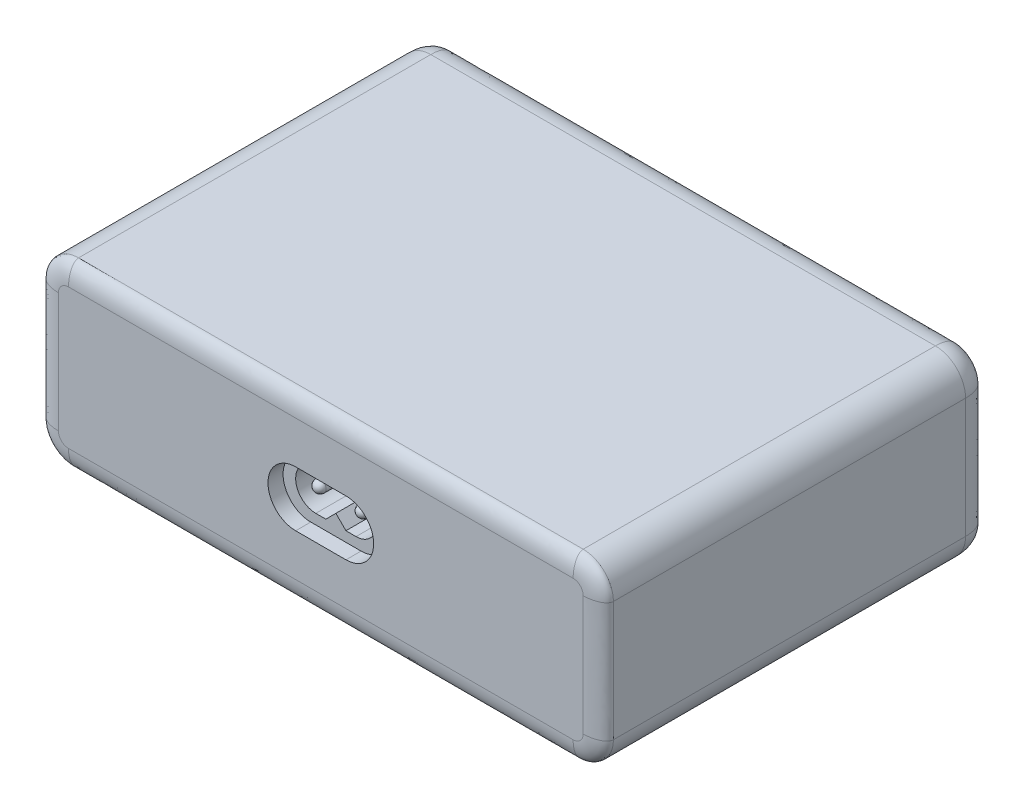
from build123d import *

# Parameters (mm, degrees)
SKETCH1_W           = 112.3
SKETCH1_H           = 76
BOSS_EXTRUDE1_DEPTH = 35.8
FILLET1_R           = 6
CUT_EXTRUDE1_DEPTH  = 3
CUT_EXTRUDE2_DEPTH  = 9.8
SKETCH4_R           = 1.18
BOSS_EXTRUDE2_DEPTH = 9.8
FILLET2_R           = 1.18
FILLET3_SIZE        = 4
FILLET3_SIZE_2      = 2
SKETCH5_W           = 12.4
SKETCH5_H           = 4.8
CUT_EXTRUDE3_DEPTH  = 10.7
CUT_EXTRUDE4_DEPTH  = 8
LPATTERN1_COUNT     = 4
LPATTERN1_PITCH     = 12.8


with BuildPart() as part:
    # Sketch1 → Boss-Extrude1 (new body)
    with BuildSketch(Plane(origin=(0, 0, 0), x_dir=(1, 0, 0), z_dir=(0, 1, 0))):
        with Locations((56.15, 38)):
            Rectangle(SKETCH1_W, SKETCH1_H)
    extrude(amount=BOSS_EXTRUDE1_DEPTH)

    # Fillet1
    fillet1_edges = [part.edges().sort_by_distance(p)[0] for p in [
        (112.3, 35.8, -38),
        (0, 35.8, -38),
        (112.3, 0, -38),
        (0, 0, -38),
    ]]
    fillet(fillet1_edges, radius=FILLET1_R)

    # Sketch2 → Cut-Extrude1 (cut)
    with BuildSketch(Plane.XY):
        with BuildLine():
            Line((51.15, 23.4), (61.15, 23.4))
            ThreePointArc((61.15, 23.4), (66.65, 17.9), (61.15, 12.4))
            Line((61.15, 12.4), (51.15, 12.4))
            ThreePointArc((51.15, 12.4), (45.65, 17.9), (51.15, 23.4))
        make_face()
    extrude(amount=-CUT_EXTRUDE1_DEPTH, mode=Mode.SUBTRACT)

    # Sketch3 → Cut-Extrude2 (cut)
    with BuildSketch(Plane.XY.offset(-3)):
        with BuildLine():
            Line((54.15, 22.4), (52.15, 22.4))
            ThreePointArc((52.15, 22.4), (48.15, 18.4), (52.15, 14.4))
            Line((52.15, 14.4), (54.162005251, 14.4))
            Line((54.162005251, 14.4), (56.15, 16.40598461))
            Line((56.15, 16.40598461), (58.137994749, 14.4))
            Line((58.137994749, 14.4), (60.15, 14.4))
            ThreePointArc((60.15, 14.4), (64.15, 18.4), (60.15, 22.4))
            Line((60.15, 22.4), (58.15, 22.4))
            Line((58.15, 22.4), (56.15, 20.40598461))
            Line((56.15, 20.40598461), (54.15, 22.4))
        make_face()
    extrude(amount=-CUT_EXTRUDE2_DEPTH, mode=Mode.SUBTRACT)

    # Sketch4 → Boss-Extrude2 (add)
    with BuildSketch(Plane.XY.offset(-12.8)):
        with Locations((51.85, 18.40598461)):
            Circle(SKETCH4_R)
        with Locations((60.45, 18.40598461)):
            Circle(SKETCH4_R)
    extrude(amount=BOSS_EXTRUDE2_DEPTH)

    # Fillet2
    fillet2_edges = [part.edges().sort_by_distance(p)[0] for p in [
        (50.67, 18.40598461, -3),
        (59.27, 18.40598461, -3),
    ]]
    fillet(fillet2_edges, radius=FILLET2_R)

    # Fillet3
    # an asymmetric fillet: 4, 2 mm, written as the material it takes off along each edge
    with BuildSketch(Plane(origin=(6, 0, 0), x_dir=(0, 1, 0), z_dir=(1, 0, 0)), Plane(origin=(106.3, 35.8, -76), x_dir=(0, 0, 1), z_dir=(-1, 0, 0))) as fillet3_piece_1:
        with BuildLine():
            Bezier((FILLET3_SIZE, 0), (0, 0), (0, -FILLET3_SIZE_2), weights=[1, 0.707106781, 1])
            Line((0, -FILLET3_SIZE_2), (0, 0))
            Line((0, 0), (FILLET3_SIZE, 0))
        make_face()
    extrude(amount=100.3, mode=Mode.SUBTRACT)
    with BuildSketch(Plane(origin=(6, 6, 0), x_dir=(-1, 0, 0), z_dir=(0, 1, 0))) as fillet3_piece_2:
        with BuildLine():
            Bezier((6 - FILLET3_SIZE, 0), (6, 0), (6, -FILLET3_SIZE_2), weights=[1, 0.707106781, 1])
            Line((6, -FILLET3_SIZE_2), (6, 0))
            Line((6, 0), (6 - FILLET3_SIZE, 0))
        make_face()
    revolve(axis=Axis((6, 6, 0), (0, 0, 1)), revolution_arc=90, mode=Mode.SUBTRACT)
    with BuildSketch(Plane(origin=(106.3, 6, 0), x_dir=(1, 0, 0), z_dir=(0, 1, 0))) as fillet3_piece_3:
        with BuildLine():
            Bezier((6 - FILLET3_SIZE, 0), (6, 0), (6, FILLET3_SIZE_2), weights=[1, 0.707106781, 1])
            Line((6, FILLET3_SIZE_2), (6, 0))
            Line((6, 0), (6 - FILLET3_SIZE, 0))
        make_face()
    revolve(axis=Axis((106.3, 6, 0), (0, 0, -1)), revolution_arc=90, mode=Mode.SUBTRACT)
    with BuildSketch(Plane(origin=(0, 6, 0), x_dir=(1, 0, 0), z_dir=(0, 1, 0)), Plane(origin=(0, 6, -76), x_dir=(0, 0, 1), z_dir=(0, 1, 0))) as fillet3_piece_4:
        with BuildLine():
            Bezier((FILLET3_SIZE, 0), (0, 0), (0, FILLET3_SIZE_2), weights=[1, 0.707106781, 1])
            Line((0, FILLET3_SIZE_2), (0, 0))
            Line((0, 0), (FILLET3_SIZE, 0))
        make_face()
    extrude(amount=23.8, mode=Mode.SUBTRACT)
    with BuildSketch(Plane(origin=(112.3, 6, 0), x_dir=(-1, 0, 0), z_dir=(0, 1, 0)), Plane(origin=(112.3, 6, -76), x_dir=(0, 0, 1), z_dir=(0, 1, 0))) as fillet3_piece_5:
        with BuildLine():
            Bezier((FILLET3_SIZE, 0), (0, 0), (0, -FILLET3_SIZE_2), weights=[1, 0.707106781, 1])
            Line((0, -FILLET3_SIZE_2), (0, 0))
            Line((0, 0), (FILLET3_SIZE, 0))
        make_face()
    extrude(amount=23.8, mode=Mode.SUBTRACT)
    with BuildSketch(Plane(origin=(6, 29.8, 0), x_dir=(-1, 0, 0), z_dir=(0, -1, 0))) as fillet3_piece_6:
        with BuildLine():
            Bezier((6 - FILLET3_SIZE, 0), (6, 0), (6, FILLET3_SIZE_2), weights=[1, 0.707106781, 1])
            Line((6, FILLET3_SIZE_2), (6, 0))
            Line((6, 0), (6 - FILLET3_SIZE, 0))
        make_face()
    revolve(axis=Axis((6, 29.8, 0), (0, 0, -1)), revolution_arc=90, mode=Mode.SUBTRACT)
    with BuildSketch(Plane(origin=(106.3, 29.8, 0), x_dir=(1, 0, 0), z_dir=(0, -1, 0))) as fillet3_piece_7:
        with BuildLine():
            Bezier((6 - FILLET3_SIZE, 0), (6, 0), (6, -FILLET3_SIZE_2), weights=[1, 0.707106781, 1])
            Line((6, -FILLET3_SIZE_2), (6, 0))
            Line((6, 0), (6 - FILLET3_SIZE, 0))
        make_face()
    revolve(axis=Axis((106.3, 29.8, 0), (0, 0, 1)), revolution_arc=90, mode=Mode.SUBTRACT)
    with BuildSketch(Plane(origin=(6, 35.8, 0), x_dir=(0, -1, 0), z_dir=(1, 0, 0)), Plane(origin=(106.3, 0, -76), x_dir=(0, 0, 1), z_dir=(-1, 0, 0))) as fillet3_piece_8:
        with BuildLine():
            Bezier((FILLET3_SIZE, 0), (0, 0), (0, FILLET3_SIZE_2), weights=[1, 0.707106781, 1])
            Line((0, FILLET3_SIZE_2), (0, 0))
            Line((0, 0), (FILLET3_SIZE, 0))
        make_face()
    extrude(amount=100.3, mode=Mode.SUBTRACT)
    with BuildSketch(Plane(origin=(106.3, 6, -76), x_dir=(1, 0, 0), z_dir=(0, 1, 0))) as fillet3_piece_9:
        with BuildLine():
            Bezier((6, -FILLET3_SIZE), (6, 0), (6 - FILLET3_SIZE_2, 0), weights=[1, 0.707106781, 1])
            Line((6 - FILLET3_SIZE_2, 0), (6, 0))
            Line((6, 0), (6, -FILLET3_SIZE))
        make_face()
    revolve(axis=Axis((106.3, 6, -76), (0, 0, -1)), revolution_arc=90, mode=Mode.SUBTRACT)
    with BuildSketch(Plane(origin=(6, 6, -76), x_dir=(-1, 0, 0), z_dir=(0, 1, 0))) as fillet3_piece_10:
        with BuildLine():
            Bezier((6, FILLET3_SIZE), (6, 0), (6 - FILLET3_SIZE_2, 0), weights=[1, 0.707106781, 1])
            Line((6 - FILLET3_SIZE_2, 0), (6, 0))
            Line((6, 0), (6, FILLET3_SIZE))
        make_face()
    revolve(axis=Axis((6, 6, -76), (0, 0, 1)), revolution_arc=90, mode=Mode.SUBTRACT)
    with BuildSketch(Plane(origin=(106.3, 29.8, -76), x_dir=(1, 0, 0), z_dir=(0, -1, 0))) as fillet3_piece_11:
        with BuildLine():
            Bezier((6, FILLET3_SIZE), (6, 0), (6 - FILLET3_SIZE_2, 0), weights=[1, 0.707106781, 1])
            Line((6 - FILLET3_SIZE_2, 0), (6, 0))
            Line((6, 0), (6, FILLET3_SIZE))
        make_face()
    revolve(axis=Axis((106.3, 29.8, -76), (0, 0, 1)), revolution_arc=90, mode=Mode.SUBTRACT)
    with BuildSketch(Plane(origin=(6, 29.8, -76), x_dir=(-1, 0, 0), z_dir=(0, -1, 0))) as fillet3_piece_12:
        with BuildLine():
            Bezier((6, -FILLET3_SIZE), (6, 0), (6 - FILLET3_SIZE_2, 0), weights=[1, 0.707106781, 1])
            Line((6 - FILLET3_SIZE_2, 0), (6, 0))
            Line((6, 0), (6, -FILLET3_SIZE))
        make_face()
    revolve(axis=Axis((6, 29.8, -76), (0, 0, -1)), revolution_arc=90, mode=Mode.SUBTRACT)

    # Sketch5 → Cut-Extrude3 (cut)
    with BuildSketch(Plane(origin=(0, 0, -76), x_dir=(-1, 0, 0), z_dir=(0, 0, -1))):
        with Locations((-94.1, 16.4)):
            Rectangle(SKETCH5_W, SKETCH5_H)
        with Locations((-75.7, 16.4)):
            Rectangle(SKETCH5_W, SKETCH5_H)
    extrude(amount=-CUT_EXTRUDE3_DEPTH, mode=Mode.SUBTRACT)

    # Sketch6 → Cut-Extrude4 (cut)
    with BuildSketch(Plane(origin=(0, 0, -76), x_dir=(-1, 0, 0), z_dir=(0, 0, -1))):
        with BuildLine():
            Line((-21.1, 17.7), (-14.1, 17.7))
            ThreePointArc((-14.1, 17.7), (-12.8, 16.4), (-14.1, 15.1))
            Line((-14.1, 15.1), (-21.1, 15.1))
            ThreePointArc((-21.1, 15.1), (-22.4, 16.4), (-21.1, 17.7))
        make_face()
    cut_extrude4 = extrude(amount=-CUT_EXTRUDE4_DEPTH, mode=Mode.SUBTRACT)

    # LPattern1: Cut-Extrude4 ×4
    with Locations(*[(i * LPATTERN1_PITCH, 0, 0) for i in range(1, LPATTERN1_COUNT)]):
        add(cut_extrude4, mode=Mode.SUBTRACT)


solid = part.part
